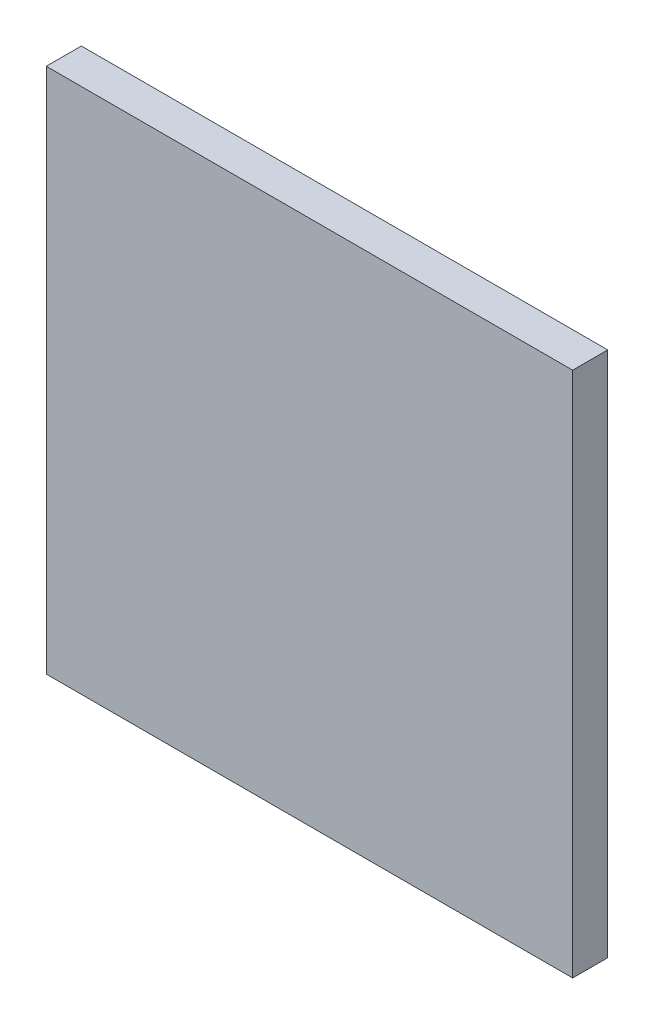
from build123d import *

# Parameters (mm, degrees)
SKETCH_2_W      = 150
SKETCH_2_H      = 150
EXTRUDE_1_DEPTH = 10


with BuildPart() as part:
    # 草图2 → 凸台-拉伸1 (new body)
    with BuildSketch(Plane.XY):
        Rectangle(SKETCH_2_W, SKETCH_2_H)
    extrude(amount=EXTRUDE_1_DEPTH)


solid = part.part
